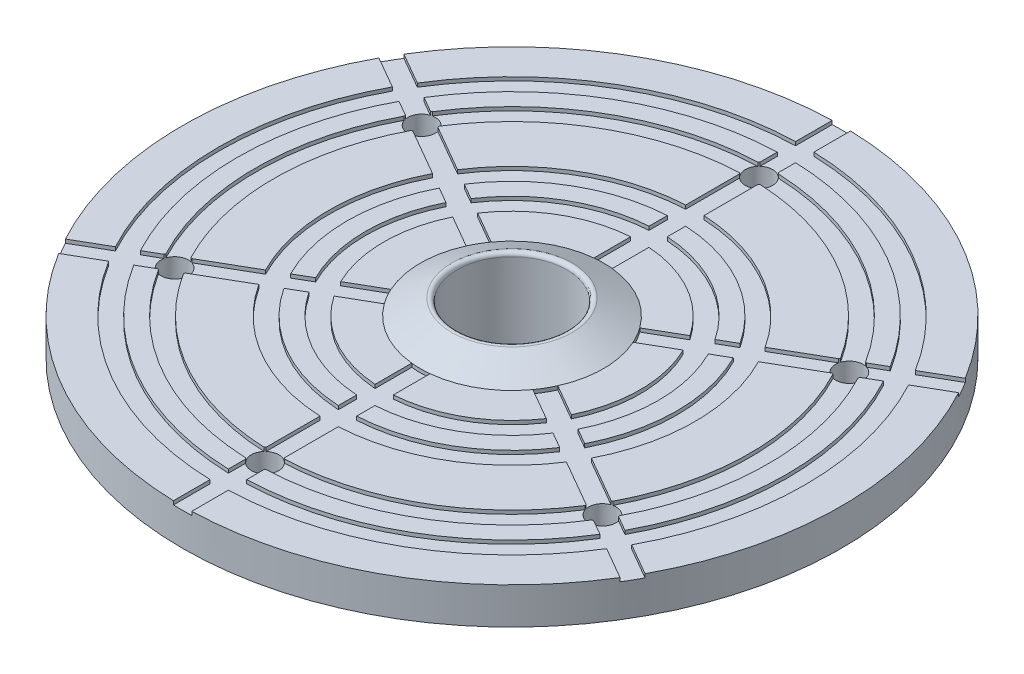
from build123d import *

# Parameters (mm, degrees)
SKETCH_2_R          = 5
SKETCH_2_R_2        = 3
EXTRUDE_1_DEPTH     = 6
EXTRUDE_START       = 2
SKETCH_2_3_R        = 6
SKETCH_2_3_R_2      = 5
EXTRUDE_2_DEPTH     = 3
EXTRUDE_START_2     = 3
SKETCH_2_4_R        = 18
SKETCH_2_4_R_2      = 8
SKETCH_2_4_R_3      = 6
EXTRUDE_3_DEPTH     = 2
CHAMFER_1_SIZE      = 1
CHAMFER_1_SIZE_2    = 2
CHAMFER_2_SIZE      = 1
CUT_EXTRUDE_START   = -0.2
CUT_EXTRUDE_1_DEPTH = 0.2
SKETCH_4_R          = 0.75
CUT_EXTRUDE_2_DEPTH = 26.942244
CHAMFER_3_SIZE      = 2
CHAMFER_3_SIZE_2    = 1
FILLET_2_R          = 0.2


with BuildPart() as part:
    # Эскиз2 → Бобышка-Вытянуть1 (new body)
    with BuildSketch(Plane(origin=(0, 0, 0), x_dir=(1, 0, 0), z_dir=(0, 1, 0))):
        with Locations(Location((0, 0, 0), (0, 0, 270))):
            Circle(SKETCH_2_R)
        with Locations(Location((0, 0, 0), (0, 0, 270))):
            Circle(SKETCH_2_R_2, mode=Mode.SUBTRACT)
    extrude(amount=EXTRUDE_1_DEPTH)

    # Эскиз2<3> → Бобышка-Вытянуть2 (add)
    with BuildSketch(Plane(origin=(0, 0, 0), x_dir=(1, 0, 0), z_dir=(0, 1, 0)).offset(EXTRUDE_START)):
        with Locations(Location((0, 0, 0), (0, 0, 270))):
            Circle(SKETCH_2_3_R)
        with Locations(Location((0, 0, 0), (0, 0, 270))):
            Circle(SKETCH_2_3_R_2, mode=Mode.SUBTRACT)
    extrude(amount=EXTRUDE_2_DEPTH)

    # Эскиз2<4> → Бобышка-Вытянуть3 (add)
    # profile 1 of 2: a face of its own
    with BuildSketch(Plane(origin=(0, 0, 0), x_dir=(1, 0, 0), z_dir=(0, 1, 0)).offset(EXTRUDE_START_2)):
        with Locations(Location((0, 0, 0), (0, 0, 270))):
            Circle(SKETCH_2_4_R)
        Circle(SKETCH_2_4_R_2, mode=Mode.SUBTRACT)
    # profile 2 of 2: a face of its own
    with BuildSketch(Plane(origin=(0, 0, 0), x_dir=(1, 0, 0), z_dir=(0, 1, 0)).offset(EXTRUDE_START_2)):
        Circle(SKETCH_2_4_R_2)
        with Locations(Location((0, 0, 0), (0, 0, 270))):
            Circle(SKETCH_2_4_R_3, mode=Mode.SUBTRACT)
    extrude(amount=EXTRUDE_3_DEPTH)

    # Фаска1
    # the kernel refuses this chamfer: 2, 1 mm, written as the material it adds along each edge
    with BuildSketch(Plane(origin=(0, 3, 0), x_dir=(0, 0, 1), z_dir=(-1, 0, 0))) as chamfer_1_piece_1_section:
        Polygon((6, -CHAMFER_1_SIZE), (6 + CHAMFER_1_SIZE_2, 0), (6, 0), align=None)
    chamfer_1_piece_1 = revolve(axis=Axis((0, 3, 0), (0, 1, 0)), mode=Mode.PRIVATE)
    chamfer_1_piece_1 = split(chamfer_1_piece_1, bisect_by=Plane(origin=(0, 2, 0), z_dir=(0, 1, 0)), keep=Keep.TOP, mode=Mode.PRIVATE)
    add(chamfer_1_piece_1)

    # Фаска2
    chamfer_2_edges = [part.edges().sort_by_distance(p)[0] for p in [
        (0, 0, -5),
    ]]
    chamfer(chamfer_2_edges, length=CHAMFER_2_SIZE)

    # Эскиз3 → Вырез-Вытянуть1 (cut)
    with BuildSketch(Plane(origin=(0, 5, 0), x_dir=(1, 0, 0), z_dir=(0, 1, 0)).offset(CUT_EXTRUDE_START)):
        with BuildLine():
            ThreePointArc((13.599639, 8.429105), (8, 13.856406), (0.5, 15.992186))
            Line((0.5, 15.992186), (0.5, 17.993054))
            ThreePointArc((0.5, 17.993054), (0, 18), (-0.5, 17.993054))
            Line((-0.5, 17.993054), (-0.5, 15.992186))
            ThreePointArc((-0.5, 15.992186), (-8, 13.856406), (-13.599639, 8.429105))
            Line((-13.599639, 8.429105), (-15.332442, 9.42954))
            ThreePointArc((-15.332442, 9.42954), (-15.588457, 9), (-15.832442, 8.563514))
            Line((-15.832442, 8.563514), (-14.099639, 7.56308))
            ThreePointArc((-14.099639, 7.56308), (-16, 0), (-14.099639, -7.56308))
            Line((-14.099639, -7.56308), (-15.832442, -8.563514))
            ThreePointArc((-15.832442, -8.563514), (-15.588457, -9), (-15.332442, -9.42954))
            Line((-15.332442, -9.42954), (-13.599639, -8.429105))
            ThreePointArc((-13.599639, -8.429105), (-8, -13.856406), (-0.5, -15.992186))
            Line((-0.5, -15.992186), (-0.5, -17.993054))
            ThreePointArc((-0.5, -17.993054), (0, -18), (0.5, -17.993054))
            Line((0.5, -17.993054), (0.5, -15.992186))
            ThreePointArc((0.5, -15.992186), (8, -13.856406), (13.599639, -8.429105))
            Line((13.599639, -8.429105), (15.332442, -9.42954))
            ThreePointArc((15.332442, -9.42954), (15.588457, -9), (15.832442, -8.563514))
            Line((15.832442, -8.563514), (14.099639, -7.56308))
            ThreePointArc((14.099639, -7.56308), (16, 0), (14.099639, 7.56308))
            Line((14.099639, 7.56308), (15.832442, 8.563514))
            ThreePointArc((15.832442, 8.563514), (15.588457, 9), (15.332442, 9.42954))
            Line((15.332442, 9.42954), (13.599639, 8.429105))
        make_face()
        with BuildLine():
            ThreePointArc((-11.866621, -7.428547), (-7, -12.124356), (-0.5, -13.991069))
            Line((-0.5, -13.991069), (-0.5, -14.991664))
            ThreePointArc((-0.5, -14.991664), (-7.5, -12.990381), (-12.733162, -7.928845))
            Line((-12.733162, -7.928845), (-11.866621, -7.428547))
        make_face(mode=Mode.SUBTRACT)
        with BuildLine():
            ThreePointArc((-8.399422, -5.426759), (-5, -8.660254), (-0.5, -9.987492))
            Line((-0.5, -9.987492), (-0.5, -12.990381))
            ThreePointArc((-0.5, -12.990381), (-6.5, -11.25833), (-11, -6.928203))
            Line((-11, -6.928203), (-8.399422, -5.426759))
        make_face(mode=Mode.SUBTRACT)
        with BuildLine():
            ThreePointArc((-12.366621, 6.562522), (-14, 0), (-12.366621, -6.562522))
            Line((-12.366621, -6.562522), (-13.233162, -7.062819))
            ThreePointArc((-13.233162, -7.062819), (-15, 0), (-13.233162, 7.062819))
            Line((-13.233162, 7.062819), (-12.366621, 6.562522))
        make_face(mode=Mode.SUBTRACT)
        with BuildLine():
            ThreePointArc((-8.899422, 4.560733), (-10, 0), (-8.899422, -4.560733))
            Line((-8.899422, -4.560733), (-11.5, -6.062178))
            ThreePointArc((-11.5, -6.062178), (-13, 0), (-11.5, 6.062178))
            Line((-11.5, 6.062178), (-8.899422, 4.560733))
        make_face(mode=Mode.SUBTRACT)
        with BuildLine():
            ThreePointArc((-6.664658, -4.425193), (-4, -6.928203), (-0.5, -7.98436))
            Line((-0.5, -7.98436), (-0.5, -8.9861))
            ThreePointArc((-0.5, -8.9861), (-4.5, -7.794229), (-7.532191, -4.926063))
            Line((-7.532191, -4.926063), (-6.664658, -4.425193))
        make_face(mode=Mode.SUBTRACT)
        with BuildLine():
            ThreePointArc((-7.164658, 3.559167), (-8, 0), (-7.164658, -3.559167))
            Line((-7.164658, -3.559167), (-8.032191, -4.060037))
            ThreePointArc((-8.032191, -4.060037), (-9, 0), (-8.032191, 4.060037))
            Line((-8.032191, 4.060037), (-7.164658, 3.559167))
        make_face(mode=Mode.SUBTRACT)
        with BuildLine():
            ThreePointArc((0.5, -13.991069), (7, -12.124356), (11.866621, -7.428547))
            Line((11.866621, -7.428547), (12.733162, -7.928845))
            ThreePointArc((12.733162, -7.928845), (7.5, -12.990381), (0.5, -14.991664))
            Line((0.5, -14.991664), (0.5, -13.991069))
        make_face(mode=Mode.SUBTRACT)
        with BuildLine():
            ThreePointArc((0.5, -9.987492), (5, -8.660254), (8.399422, -5.426759))
            Line((8.399422, -5.426759), (11, -6.928203))
            ThreePointArc((11, -6.928203), (6.5, -11.25833), (0.5, -12.990381))
            Line((0.5, -12.990381), (0.5, -9.987492))
        make_face(mode=Mode.SUBTRACT)
        with BuildLine():
            ThreePointArc((0.5, -7.98436), (4, -6.928203), (6.664658, -4.425193))
            Line((6.664658, -4.425193), (7.532191, -4.926063))
            ThreePointArc((7.532191, -4.926063), (4.5, -7.794229), (0.5, -8.9861))
            Line((0.5, -8.9861), (0.5, -7.98436))
        make_face(mode=Mode.SUBTRACT)
        with BuildLine():
            ThreePointArc((-0.5, 4.974937), (0, 5), (0.5, 4.974937))
            Line((0.5, 4.974937), (0.5, 6.98212))
            ThreePointArc((0.5, 6.98212), (3.5, 6.062178), (5.796693, 3.924073))
            Line((5.796693, 3.924073), (4.058422, 2.920481))
            ThreePointArc((4.058422, 2.920481), (4.330127, 2.5), (4.558422, 2.054456))
            Line((4.558422, 2.054456), (6.296693, 3.058047))
            ThreePointArc((6.296693, 3.058047), (7, 0), (6.296693, -3.058047))
            Line((6.296693, -3.058047), (4.558422, -2.054456))
            ThreePointArc((4.558422, -2.054456), (4.330127, -2.5), (4.058422, -2.920481))
            Line((4.058422, -2.920481), (5.796693, -3.924073))
            ThreePointArc((5.796693, -3.924073), (3.5, -6.062178), (0.5, -6.98212))
            Line((0.5, -6.98212), (0.5, -4.974937))
            ThreePointArc((0.5, -4.974937), (0, -5), (-0.5, -4.974937))
            Line((-0.5, -4.974937), (-0.5, -6.98212))
            ThreePointArc((-0.5, -6.98212), (-3.5, -6.062178), (-5.796693, -3.924073))
            Line((-5.796693, -3.924073), (-4.058422, -2.920481))
            ThreePointArc((-4.058422, -2.920481), (-4.330127, -2.5), (-4.558422, -2.054456))
            Line((-4.558422, -2.054456), (-6.296693, -3.058047))
            ThreePointArc((-6.296693, -3.058047), (-7, 0), (-6.296693, 3.058047))
            Line((-6.296693, 3.058047), (-4.558422, 2.054456))
            ThreePointArc((-4.558422, 2.054456), (-4.330127, 2.5), (-4.058422, 2.920481))
            Line((-4.058422, 2.920481), (-5.796693, 3.924073))
            ThreePointArc((-5.796693, 3.924073), (-3.5, 6.062178), (-0.5, 6.98212))
            Line((-0.5, 6.98212), (-0.5, 4.974937))
        make_face(mode=Mode.SUBTRACT)
        with BuildLine():
            Line((-0.5, 8.9861), (-0.5, 7.98436))
            ThreePointArc((-0.5, 7.98436), (-4, 6.928203), (-6.664658, 4.425193))
            Line((-6.664658, 4.425193), (-7.532191, 4.926063))
            ThreePointArc((-7.532191, 4.926063), (-4.5, 7.794229), (-0.5, 8.9861))
        make_face(mode=Mode.SUBTRACT)
        with BuildLine():
            Line((-0.5, 12.990381), (-0.5, 9.987492))
            ThreePointArc((-0.5, 9.987492), (-5, 8.660254), (-8.399422, 5.426759))
            Line((-8.399422, 5.426759), (-11, 6.928203))
            ThreePointArc((-11, 6.928203), (-6.5, 11.25833), (-0.5, 12.990381))
        make_face(mode=Mode.SUBTRACT)
        with BuildLine():
            Line((-0.5, 14.991664), (-0.5, 13.991069))
            ThreePointArc((-0.5, 13.991069), (-7, 12.124356), (-11.866621, 7.428547))
            Line((-11.866621, 7.428547), (-12.733162, 7.928845))
            ThreePointArc((-12.733162, 7.928845), (-7.5, 12.990381), (-0.5, 14.991664))
        make_face(mode=Mode.SUBTRACT)
        with BuildLine():
            ThreePointArc((7.164658, -3.559167), (8, 0), (7.164658, 3.559167))
            Line((7.164658, 3.559167), (8.032191, 4.060037))
            ThreePointArc((8.032191, 4.060037), (9, 0), (8.032191, -4.060037))
            Line((8.032191, -4.060037), (7.164658, -3.559167))
        make_face(mode=Mode.SUBTRACT)
        with BuildLine():
            ThreePointArc((6.664658, 4.425193), (4, 6.928203), (0.5, 7.98436))
            Line((0.5, 7.98436), (0.5, 8.9861))
            ThreePointArc((0.5, 8.9861), (4.5, 7.794229), (7.532191, 4.926063))
            Line((7.532191, 4.926063), (6.664658, 4.425193))
        make_face(mode=Mode.SUBTRACT)
        with BuildLine():
            ThreePointArc((8.899422, -4.560733), (10, 0), (8.899422, 4.560733))
            Line((8.899422, 4.560733), (11.5, 6.062178))
            ThreePointArc((11.5, 6.062178), (13, 0), (11.5, -6.062178))
            Line((11.5, -6.062178), (8.899422, -4.560733))
        make_face(mode=Mode.SUBTRACT)
        with BuildLine():
            ThreePointArc((12.366621, -6.562522), (14, 0), (12.366621, 6.562522))
            Line((12.366621, 6.562522), (13.233162, 7.062819))
            ThreePointArc((13.233162, 7.062819), (15, 0), (13.233162, -7.062819))
            Line((13.233162, -7.062819), (12.366621, -6.562522))
        make_face(mode=Mode.SUBTRACT)
        with BuildLine():
            ThreePointArc((8.399422, 5.426759), (5, 8.660254), (0.5, 9.987492))
            Line((0.5, 9.987492), (0.5, 12.990381))
            ThreePointArc((0.5, 12.990381), (6.5, 11.25833), (11, 6.928203))
            Line((11, 6.928203), (8.399422, 5.426759))
        make_face(mode=Mode.SUBTRACT)
        with BuildLine():
            ThreePointArc((11.866621, 7.428547), (7, 12.124356), (0.5, 13.991069))
            Line((0.5, 13.991069), (0.5, 14.991664))
            ThreePointArc((0.5, 14.991664), (7.5, 12.990381), (12.733162, 7.928845))
            Line((12.733162, 7.928845), (11.866621, 7.428547))
        make_face(mode=Mode.SUBTRACT)
    extrude(amount=CUT_EXTRUDE_1_DEPTH, mode=Mode.SUBTRACT)

    # Эскиз4 → Вырез-Вытянуть2 (cut, through all)
    with BuildSketch(Plane(origin=(0, 5, 0), x_dir=(1, 0, 0), z_dir=(0, 1, 0))):
        with Locations(Location((0, 13.490725, 0), (0, 0, 270))):
            Circle(SKETCH_4_R)
        with Locations(Location((11.68331, 6.745362, 0), (0, 0, 270))):
            Circle(SKETCH_4_R)
        with Locations(Location((11.68331, -6.745362, 0), (0, 0, 270))):
            Circle(SKETCH_4_R)
        with Locations(Location((0, -13.490725, 0), (0, 0, 270))):
            Circle(SKETCH_4_R)
        with Locations(Location((-11.68331, -6.745362, 0), (0, 0, 270))):
            Circle(SKETCH_4_R)
        with Locations(Location((-11.68331, 6.745362, 0), (0, 0, 270))):
            Circle(SKETCH_4_R)
    extrude(amount=-CUT_EXTRUDE_2_DEPTH, mode=Mode.SUBTRACT)

    # Фаска3
    # the kernel refuses this chamfer: 2, 1 mm, written as the material it takes off along each edge
    with BuildSketch(Plane(origin=(0, 6, 0), x_dir=(0, 0, 1), z_dir=(-1, 0, 0))) as chamfer_3_piece_1:
        Polygon((5 - CHAMFER_3_SIZE, 0), (5, -CHAMFER_3_SIZE_2), (5, 0), align=None)
    revolve(axis=Axis((0, 6, 0), (0, 1, 0)), mode=Mode.SUBTRACT)

    # Скругление2
    fillet_2_edges = [part.edges().sort_by_distance(p)[0] for p in [
        (0, 6, -3),
    ]]
    fillet(fillet_2_edges, radius=FILLET_2_R)


solid = part.part
